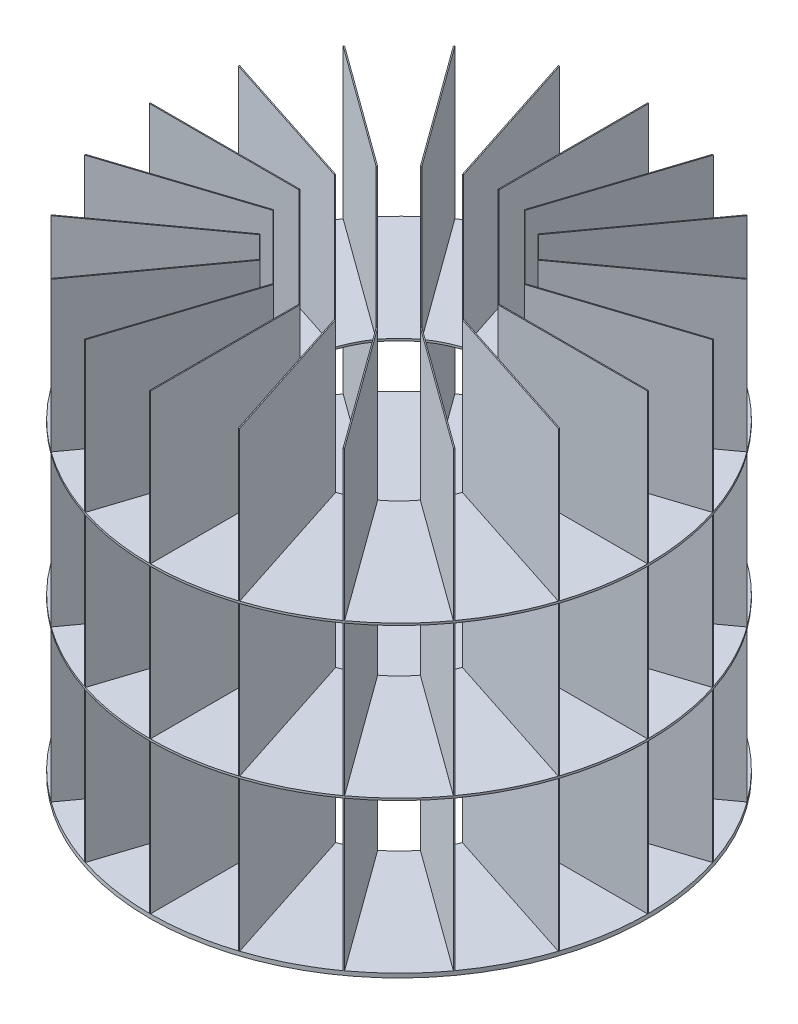
from build123d import *

# Parameters (mm, degrees)
SKETCH2_R           = 381
SKETCH2_R_2         = 152.4
BOSS_EXTRUDE1_DEPTH = 6.35
BOSS_EXTRUDE2_DEPTH = 228.6
CIRPATTERN1_COUNT   = 20
SKETCH4_R           = 381.000263155
SKETCH4_R_2         = 152.4
BOSS_EXTRUDE3_DEPTH = 3.175
LPATTERN2_START     = 238.125
LPATTERN2_DEPTH     = 228.6
SKETCH5_R           = 381.000263155
SKETCH5_R_2         = 152.4
BOSS_EXTRUDE4_DEPTH = 3.175
LPATTERN3_COUNT     = 2
LPATTERN3_PITCH     = 231.775


# Read off the part's stored shape, not the designer's step: LPattern2
with BuildPart() as part:
    # Sketch2 → Boss-Extrude1 (new body)
    with BuildSketch(Plane(origin=(0, 0, 0), x_dir=(1, 0, 0), z_dir=(0, 1, 0))):
        with Locations(Location((0, 0, 0), (0, 0, 270))):
            Circle(SKETCH2_R)
        with Locations(Location((0, 0, 0), (0, 0, 270))):
            Circle(SKETCH2_R_2, mode=Mode.SUBTRACT)
    extrude(amount=BOSS_EXTRUDE1_DEPTH)

    # Sketch3 → Boss-Extrude2 (add)
    with BuildSketch(Plane(origin=(0, 6.35, 0), x_dir=(1, 0, 0), z_dir=(0, 1, 0))):
        Polygon((0, 152.4), (0.793747309, 152.397932943), (0.793747309, 380.999173182), (-0.793752691, 380.999173171), (-0.793752691, 152.4), align=None)
    boss_extrude2 = extrude(amount=BOSS_EXTRUDE2_DEPTH)

    # CirPattern1: Boss-Extrude2 ×20 about axis
    cirpattern1_axis = Axis((0, 0, 0), (0, 1, 0))
    for i in range(1, CIRPATTERN1_COUNT):
        add(boss_extrude2.rotate(cirpattern1_axis, i * 360 / CIRPATTERN1_COUNT))

    # Sketch4 → Boss-Extrude3 (add)
    with BuildSketch(Plane(origin=(0, 234.95, 0), x_dir=(1, 0, 0), z_dir=(0, 1, 0))):
        with Locations(Location((0, 0, 0), (0, 0, 89.880634111))):
            Circle(SKETCH4_R)
        with Locations(Location((0, 0, 0), (0, 0, 270))):
            Circle(SKETCH4_R_2, mode=Mode.SUBTRACT)
    extrude(amount=BOSS_EXTRUDE3_DEPTH)

    # LPattern2 outline → LPattern2 (add)
    with BuildSketch(Plane(origin=(0, 0, 0), x_dir=(1, 0, 0), z_dir=(0, 1, 0)).offset(LPATTERN2_START)):
        Polygon((-0.793752691, 380.999173171), (-0.793752691, 152.4), (0, 152.4), (0.793747309, 152.397932943), (0.793747309, 380.999173182), align=None)
        Polygon((0.793752691, -380.999173171), (0.793752691, -152.4), (0, -152.4), (-0.793747309, -152.397932943), (-0.793747309, -380.999173182), align=None)
        Polygon((-118.490123022, 362.106463276), (-47.849093612, 144.695730012), (-47.094189943, 144.941013083), (-46.338650631, 145.184329248), (-116.980320806, 362.597027765), align=None)
        Polygon((118.490123022, -362.106463275), (47.849093612, -144.695730012), (47.094189943, -144.941013083), (46.33865064, -145.184329246), (116.980320806, -362.597027765), align=None)
        Polygon((-224.587854542, 307.768249812), (-90.220631866, 122.827633817), (-89.578472345, 123.294190019), (-88.93510172, 123.759071113), (-223.30354007, 308.701358909), align=None)
        Polygon((224.587854542, -307.768249812), (90.220631866, -122.827633817), (89.578472345, -123.294190019), (88.93510172, -123.759071113), (223.30354007, -308.701358909), align=None)
        Polygon((-308.701362064, 223.303535708), (-123.760746069, 88.936313033), (-123.294189943, 89.578472449), (-122.825964112, 90.219413326), (-307.768252985, 224.587850194), align=None)
        Polygon((308.701362064, -223.303535709), (123.760746069, -88.936313033), (123.294189943, -89.578472449), (122.825964112, -90.219413326), (307.768252985, -224.587850193), align=None)
        Polygon((-362.597029418, 116.980315682), (-145.186296154, 46.339286273), (-144.941013036, 47.094190088), (-144.693765105, 47.848451818), (-362.10646495, 118.490117906), align=None)
        Polygon((362.597029418, -116.980315682), (145.186296154, -46.339286273), (144.941013037, -47.094190087), (144.693765104, -47.848451821), (362.10646495, -118.490117906), align=None)
        Polygon((-380.999173171, -0.793752691), (-152.4, -0.793752691), (-152.4, 0), (-152.397932943, 0.793747337), (-380.999173182, 0.793747309), align=None)
        Polygon((380.999173171, 0.793752691), (152.4, 0.793752691), (152.4, 0), (152.397932943, -0.793747335), (380.999173182, -0.793747309), align=None)
        Polygon((-362.106463275, -118.490123022), (-144.695730012, -47.849093612), (-144.941013083, -47.094189943), (-145.184329248, -46.338650631), (-362.597027765, -116.980320806), align=None)
        Polygon((362.106463275, 118.490123022), (144.695730012, 47.849093612), (144.941013083, 47.094189943), (145.184329247, 46.338650635), (362.597027765, 116.980320806), align=None)
        Polygon((-307.768249811, -224.587854542), (-122.827633817, -90.220631866), (-123.294190019, -89.578472345), (-123.759071113, -88.93510172), (-308.701358909, -223.30354007), align=None)
        Polygon((307.768249812, 224.587854542), (122.827633817, 90.220631866), (123.294190019, 89.578472345), (123.759071113, 88.93510172), (308.701358909, 223.30354007), align=None)
        Polygon((-223.303535708, -308.701362064), (-88.936313033, -123.760746069), (-89.578472449, -123.294189943), (-90.219413326, -122.825964112), (-224.587850194, -307.768252985), align=None)
        Polygon((223.303535709, 308.701362064), (88.936313033, 123.760746069), (89.578472449, 123.294189943), (90.219413326, 122.825964112), (224.587850193, 307.768252985), align=None)
        Polygon((-116.980315682, -362.597029418), (-46.339286273, -145.186296154), (-47.094190088, -144.941013036), (-47.848451818, -144.693765105), (-118.490117906, -362.10646495), align=None)
        Polygon((116.980315683, 362.597029418), (46.339286273, 145.186296154), (47.094190088, 144.941013036), (47.848451818, 144.693765105), (118.490117906, 362.10646495), align=None)
    lpattern2 = extrude(amount=LPATTERN2_DEPTH)

    # Sketch5 → Boss-Extrude4 (add)
    with BuildSketch(Plane(origin=(0, 466.725, 0), x_dir=(1, 0, 0), z_dir=(0, 1, 0))):
        with Locations(Location((0, 0, 0), (0, 0, 89.880634111))):
            Circle(SKETCH5_R)
        with Locations(Location((0, 0, 0), (0, 0, 270))):
            Circle(SKETCH5_R_2, mode=Mode.SUBTRACT)
    extrude(amount=BOSS_EXTRUDE4_DEPTH)

    # LPattern3: LPattern2 ×2
    with Locations(*[(0, i * LPATTERN3_PITCH, 0) for i in range(1, LPATTERN3_COUNT)]):
        add(lpattern2)


solid = part.part
